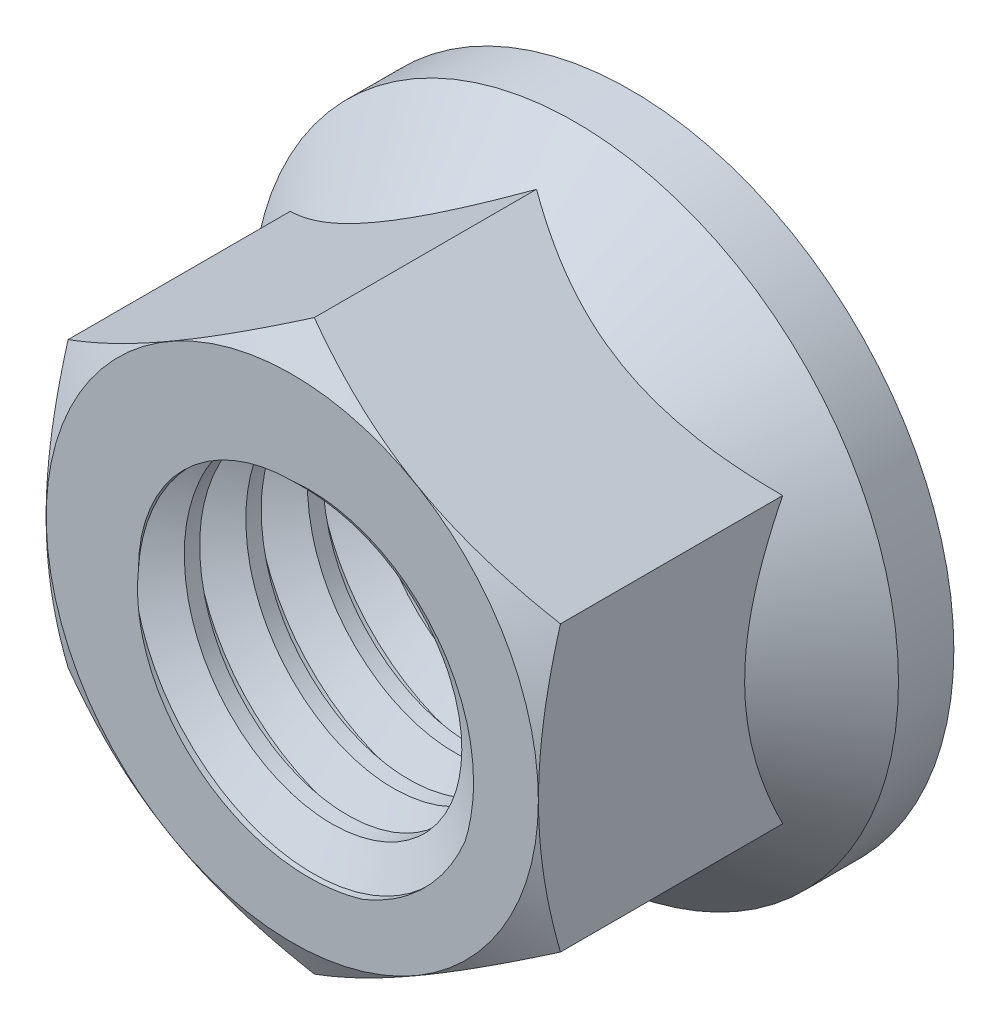
from build123d import *

# Parameters (mm, degrees)
CROQUIS1_R              = 2.5
SALIENTE_EXTRUIR1_DEPTH = 2.75
CROQUIS3_R              = 5.25
CROQUIS3_R_2            = 4
SALIENTE_EXTRUIR2_DEPTH = 0.9
ROSCA3_PITCH            = 1


with BuildPart() as part:
    # Croquis1 → Saliente-Extruir1 (new, symmetric)
    with BuildSketch(Plane.XY):
        Polygon((0, 4.618802154), (-4, 2.309401077), (-4, -2.309401077), (0, -4.618802154), (4, -2.309401077), (4, 2.309401077), align=None)
        Circle(CROQUIS1_R, mode=Mode.SUBTRACT)
    extrude(amount=SALIENTE_EXTRUIR1_DEPTH, both=True)

    # Croquis2 → Cortar-Revolución1 (revolve, cut)
    with BuildSketch(Plane(origin=(0, 0, 0), x_dir=(0, 0, -1), z_dir=(1, 0, 0)), mode=Mode.PRIVATE) as cortar_revoluci_n1_sk:
        Polygon((-2.392042833, 4.618802154), (-2.75, 3.998802154), (-2.75, 4.618802154), align=None)
    revolve(cortar_revoluci_n1_sk.sketch.rotate(Axis((0, 0, 2.75), (0, 0, -1)), 300.000000004), axis=Axis((0, 0, 2.75), (0, 0, -1)), mode=Mode.SUBTRACT)

    # Croquis3 → Saliente-Extruir2 (add)
    with BuildSketch(Plane(origin=(0, 0, -2.75), x_dir=(-1, 0, 0), z_dir=(0, 0, -1))):
        Circle(CROQUIS3_R)
        Circle(CROQUIS3_R_2, mode=Mode.SUBTRACT)
    extrude(amount=-SALIENTE_EXTRUIR2_DEPTH)

    # Croquis5 → Revolución1 (revolve)
    with BuildSketch(Plane(origin=(0, 0, 0), x_dir=(1, 0, 0), z_dir=(0, 1, 0)), mode=Mode.PRIVATE) as revoluci_n1_sk:
        Polygon((-4, 1.85), (-5.25, 1.85), (-4, 0.6), align=None)
    revolve(revoluci_n1_sk.sketch.rotate(Axis((0, 0, -1.85), (0, 0, 1)), 329.999999996), axis=Axis((0, 0, -1.85), (0, 0, 1)))

    # Rosca3: the profile of Perfil de rosca4 profile screwed along a right-hand helix of 6.5 turns, 8 arcs to a turn; built about Z, then put on its axis
    rosca3_z = Axis((0, 0, 0), (0, 0, 1))
    rosca3_corners = [(2.4997, 0, -0.000173205), (3.041265875, 0, 0.312499999), (3.041265875, 0, 0.437499999), (2.4997, 0, 0.750173202)]
    with BuildLine(mode=Mode.PRIVATE) as rosca3_profile:
        Line(rosca3_corners[0], rosca3_corners[1])
        Line(rosca3_corners[1], rosca3_corners[2])
        Line(rosca3_corners[2], rosca3_corners[3])
        Line(rosca3_corners[3], rosca3_corners[0])
    rosca3_cap = Face(rosca3_profile.wire())
    rosca3_turn_angles = [0, 22.5, 45, 67.5, 90, 112.5, 135, 157.5, 180, 202.5, 225, 247.5, 270, 292.5, 315, 337.5, 360]
    rosca3_turn_weights = [1, 0.9238795325112867, 1, 0.9238795325112867, 1, 0.9238795325112867, 1, 0.9238795325112867, 1, 0.9238795325112867, 1, 0.9238795325112867, 1, 0.9238795325112867, 1, 0.9238795325112867, 1]
    rosca3_turn_rails = [Edge.make_bspline([Vector(p[0], p[1], 0).rotate(rosca3_z, rosca3_turn_angles[k]) / rosca3_turn_weights[k] + Vector(0, 0, p[2] + ROSCA3_PITCH * rosca3_turn_angles[k] / 360) for k in range(17)], [0, 0, 0, 1, 1, 2, 2, 3, 3, 4, 4, 5, 5, 6, 6, 7, 7, 8, 8, 8], 2, rosca3_turn_weights) for p in rosca3_corners]
    rosca3_turn_sides = [Face.make_surface_from_curves(rosca3_turn_rails[p[0]], rosca3_turn_rails[p[1]]) for p in [(0, 1), (1, 2), (2, 3), (3, 0)]]
    rosca3_last_angles = [2160, 2182.5, 2205, 2227.5, 2250, 2272.5, 2295, 2317.5, 2340]
    rosca3_last_weights = [1, 0.9238795325112867, 1, 0.9238795325112867, 1, 0.9238795325112867, 1, 0.9238795325112867, 1]
    rosca3_last_rails = [Edge.make_bspline([Vector(p[0], p[1], 0).rotate(rosca3_z, rosca3_last_angles[k]) / rosca3_last_weights[k] + Vector(0, 0, p[2] + ROSCA3_PITCH * rosca3_last_angles[k] / 360) for k in range(9)], [0, 0, 0, 1, 1, 2, 2, 3, 3, 4, 4, 4], 2, rosca3_last_weights) for p in rosca3_corners]
    rosca3_last_sides = [Face.make_surface_from_curves(rosca3_last_rails[p[0]], rosca3_last_rails[p[1]]) for p in [(0, 1), (1, 2), (2, 3), (3, 0)]]
    rosca3 = Plane(origin=(0, 0, 3.75), x_dir=(-1, 0, 0), z_dir=(0, 0, -1)) * Solid(Shell([*[p.moved(Location((0, 0, ROSCA3_PITCH * i))) for i in range(6) for p in rosca3_turn_sides], *rosca3_last_sides, rosca3_cap, rosca3_cap.rotate(rosca3_z, 2340).moved(Location((0, 0, ROSCA3_PITCH * 2340 / 360)))]))
    add(rosca3, mode=Mode.SUBTRACT)


solid = part.part
